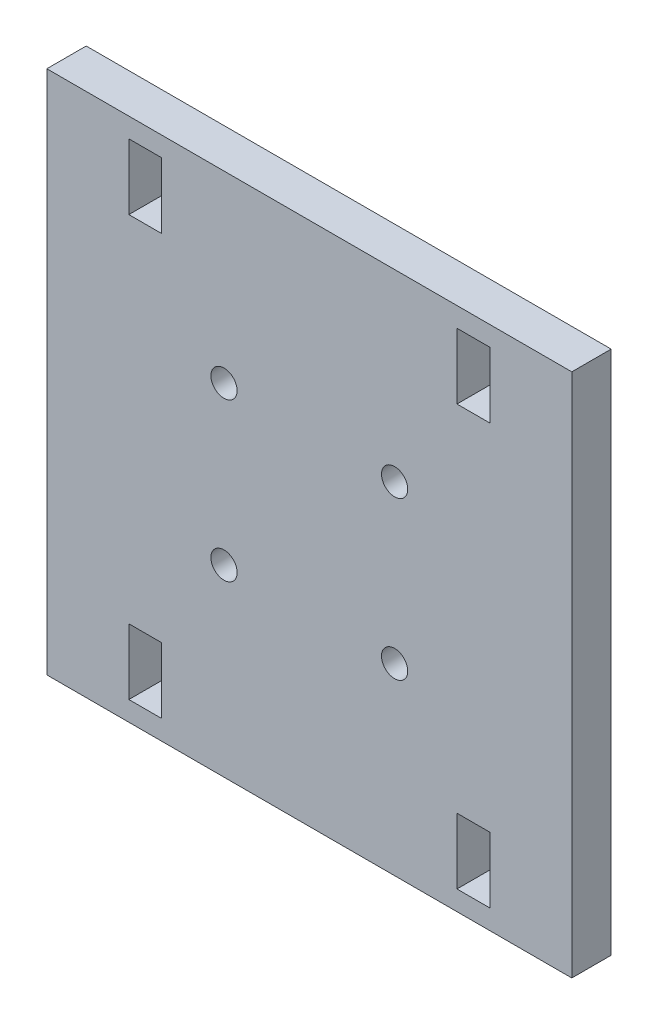
from build123d import *

# Parameters (mm, degrees)
SKETCH1_W           = 40
SKETCH1_H           = 40
SKETCH1_R           = 1
BOSS_EXTRUDE1_DEPTH = 3
SKETCH2_W           = 2.5
SKETCH2_H           = 5
CUT_EXTRUDE1_DEPTH  = 5


with BuildPart() as part:
    # Sketch1 → Boss-Extrude1 (new body)
    with BuildSketch(Plane.XY):
        Rectangle(SKETCH1_W, SKETCH1_H)
        with Locations((6.5, -6)):
            Circle(SKETCH1_R, mode=Mode.SUBTRACT)
        with Locations((-6.5, -6)):
            Circle(SKETCH1_R, mode=Mode.SUBTRACT)
        with Locations((6.5, 6)):
            Circle(SKETCH1_R, mode=Mode.SUBTRACT)
        with Locations((-6.5, 6)):
            Circle(SKETCH1_R, mode=Mode.SUBTRACT)
    extrude(amount=BOSS_EXTRUDE1_DEPTH)

    # Sketch2 → Cut-Extrude1 (cut)
    with BuildSketch(Plane.XY.offset(3)):
        with Locations((12.5, 16)):
            Rectangle(SKETCH2_W, SKETCH2_H)
        with Locations((12.5, -16)):
            Rectangle(SKETCH2_W, SKETCH2_H)
        with Locations((-12.5, -16)):
            Rectangle(SKETCH2_W, SKETCH2_H)
        with Locations((-12.5, 16)):
            Rectangle(SKETCH2_W, SKETCH2_H)
    extrude(amount=-CUT_EXTRUDE1_DEPTH, mode=Mode.SUBTRACT)


solid = part.part
